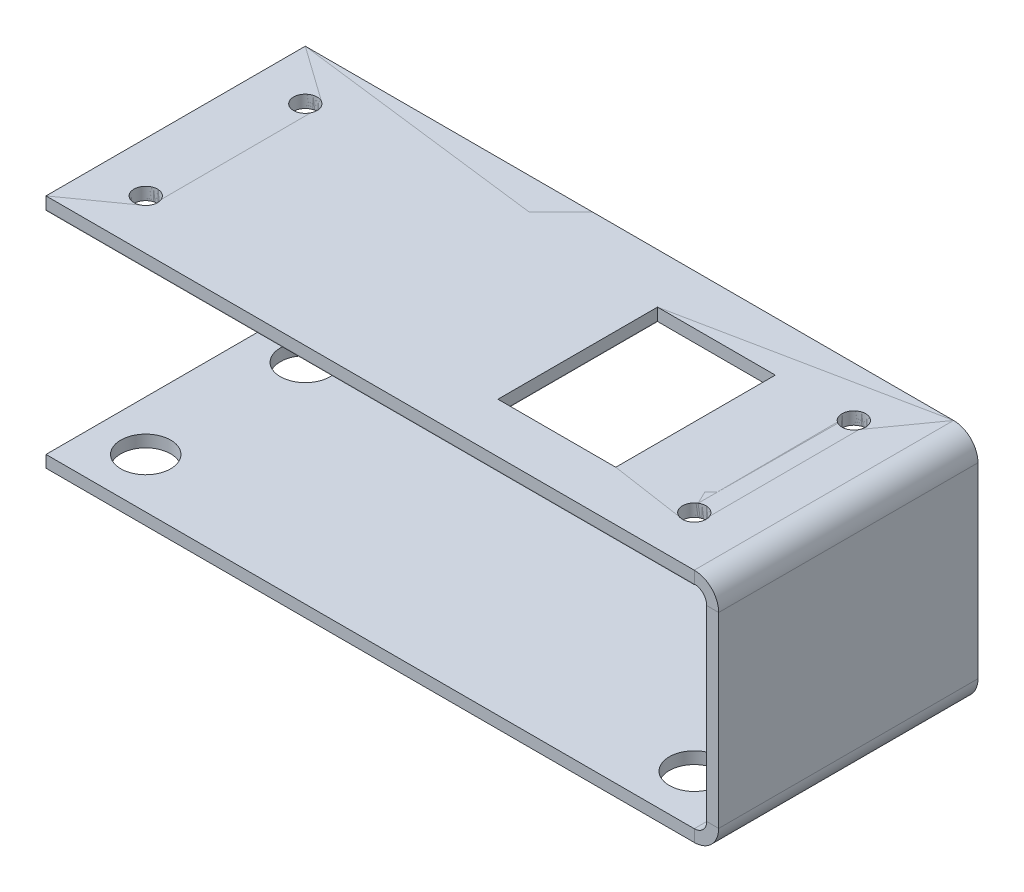
from build123d import *

# Parameters (mm, degrees)
ESQUISSE1_W                      = 82.55
ESQUISSE1_H                      = 33.02
ESQUISSE1_R                      = 1.5
ESQUISSE1_W_2                    = 15
ESQUISSE1_H_2                    = 20.32
BOSS_EXTRU_1_DEPTH               = 1.5875
CONVERTIR_VOLUME1_START          = 0.0635
CONVERTIR_VOLUME1_OUTLINE_W      = 82.55
CONVERTIR_VOLUME1_OUTLINE_H      = 33.02
CONVERTIR_VOLUME1_OUTLINE_R      = 1.5
CONVERTIR_VOLUME1_OUTLINE_W_2    = 15
CONVERTIR_VOLUME1_OUTLINE_H_2    = 20.32
CONVERTIR_VOLUME1_DEPTH          = 1.524
T_LE_PLI_E_SUR_AR_TE3_DEPTH      = 33.02
T_LE_PLI_E_SUR_AR_TE4_DEPTH      = 33.02
T_LE_START                       = 1.524
T_LE_PLI_E_SUR_AR_TE4_PROFILE_W  = 33.02
T_LE_PLI_E_SUR_AR_TE4_PROFILE_H  = 82.55
T_LE_PLI_E_SUR_AR_TE4_PROFILE_R  = 3.175
T_LE_PLI_E_SUR_AR_TE4_FLAT_DEPTH = 1.524


# Read off the part's stored shape, not the designer's step: Convertir-Volume1
# Sheet-metal steps are written as plain solids
with BuildPart() as part:
    # Esquisse1 → Boss.-Extru.1 (new body)
    with BuildSketch(Plane(origin=(0, 0, 0), x_dir=(1, 0, 0), z_dir=(0, 1, 0))):
        with Locations((41.275, 16.51)):
            Rectangle(ESQUISSE1_W, ESQUISSE1_H)
        with Locations(Location((6.35, 26.67, 0), (0, 0, 270))):
            Circle(ESQUISSE1_R, mode=Mode.SUBTRACT)
        with Locations(Location((76.2, 26.67, 0), (0, 0, 270))):
            Circle(ESQUISSE1_R, mode=Mode.SUBTRACT)
        with Locations(Location((76.2, 6.349999837, 0), (0, 0, 270))):
            Circle(ESQUISSE1_R, mode=Mode.SUBTRACT)
        with Locations(Location((6.35, 6.349999837, 0), (0, 0, 270))):
            Circle(ESQUISSE1_R, mode=Mode.SUBTRACT)
        with Locations((58.7, 16.51)):
            Rectangle(ESQUISSE1_W_2, ESQUISSE1_H_2, mode=Mode.SUBTRACT)
    extrude(amount=BOSS_EXTRU_1_DEPTH)


with BuildPart() as body_2:
    # Convertir-Volume1 outline → Convertir-Volume1 (new body)
    with BuildSketch(Plane(origin=(0, 0, 0), x_dir=(1, 0, 0), z_dir=(0, 1, 0)).offset(CONVERTIR_VOLUME1_START)):
        with Locations((41.275, 16.51)):
            Rectangle(CONVERTIR_VOLUME1_OUTLINE_W, CONVERTIR_VOLUME1_OUTLINE_H)
        with Locations((6.35, 6.349999837)):
            Circle(CONVERTIR_VOLUME1_OUTLINE_R, mode=Mode.SUBTRACT)
        with Locations((76.2, 6.349999837)):
            Circle(CONVERTIR_VOLUME1_OUTLINE_R, mode=Mode.SUBTRACT)
        with Locations((6.35, 26.67)):
            Circle(CONVERTIR_VOLUME1_OUTLINE_R, mode=Mode.SUBTRACT)
        with Locations((58.7, 16.51)):
            Rectangle(CONVERTIR_VOLUME1_OUTLINE_W_2, CONVERTIR_VOLUME1_OUTLINE_H_2, mode=Mode.SUBTRACT)
        with Locations((76.2, 26.67)):
            Circle(CONVERTIR_VOLUME1_OUTLINE_R, mode=Mode.SUBTRACT)
    extrude(amount=CONVERTIR_VOLUME1_DEPTH)

    # Tôle pliée sur arête3 section (across the edge) → Tôle pliée sur arête3 (add)
    with BuildSketch(Plane(origin=(84.1375, 0.0635, -33.02), x_dir=(-1, 0, 0), z_dir=(0, 0, 1))):
        with BuildLine():
            Line((-1.524, 1.5875), (-1.524, 25.4))
            Line((-1.524, 25.4), (0, 25.4))
            Line((0, 25.4), (0, 1.5875))
            ThreePointArc((0, 1.5875), (0.464967985, 0.464967985), (1.5875, 0))
            Line((1.5875, 0), (1.5875, -1.524))
            ThreePointArc((1.5875, -1.524), (-0.61266275, -0.61266275), (-1.524, 1.5875))
        make_face()
    extrude(amount=T_LE_PLI_E_SUR_AR_TE3_DEPTH)

    # Tôle pliée sur arête4 bend section (across the edge) → Tôle pliée sur arête4 (add)
    with BuildSketch(Plane(origin=(84.1375, -26.924, -33.02), x_dir=(0, 1, 0), z_dir=(0, 0, 1))):
        with BuildLine():
            Line((-1.524, 1.5875), (0, 1.5875))
            ThreePointArc((0, 1.5875), (0.464967985, 0.464967985), (1.5875, 0))
            Line((1.5875, 0), (1.5875, -1.524))
            ThreePointArc((1.5875, -1.524), (-0.61266275, -0.61266275), (-1.524, 1.5875))
        make_face()
    extrude(amount=T_LE_PLI_E_SUR_AR_TE4_DEPTH)

    # Tôle pliée sur arête4 profile (on flange) → Tôle pliée sur arête4 flat (add)
    with BuildSketch(Plane(origin=(84.1375, -26.924, 0), x_dir=(0, 0, 1), z_dir=(0, -1, 0)).offset(T_LE_START)):
        with Locations((-16.51, 42.8625)):
            Rectangle(T_LE_PLI_E_SUR_AR_TE4_PROFILE_W, T_LE_PLI_E_SUR_AR_TE4_PROFILE_H)
        with Locations((-26.67, 7.9375)):
            Circle(T_LE_PLI_E_SUR_AR_TE4_PROFILE_R, mode=Mode.SUBTRACT)
        with Locations((-6.35, 7.9375)):
            Circle(T_LE_PLI_E_SUR_AR_TE4_PROFILE_R, mode=Mode.SUBTRACT)
        with Locations((-26.67, 77.7875)):
            Circle(T_LE_PLI_E_SUR_AR_TE4_PROFILE_R, mode=Mode.SUBTRACT)
        with Locations((-6.35, 77.7875)):
            Circle(T_LE_PLI_E_SUR_AR_TE4_PROFILE_R, mode=Mode.SUBTRACT)
    extrude(amount=-T_LE_PLI_E_SUR_AR_TE4_FLAT_DEPTH)


solid = Compound([part.part, body_2.part])
